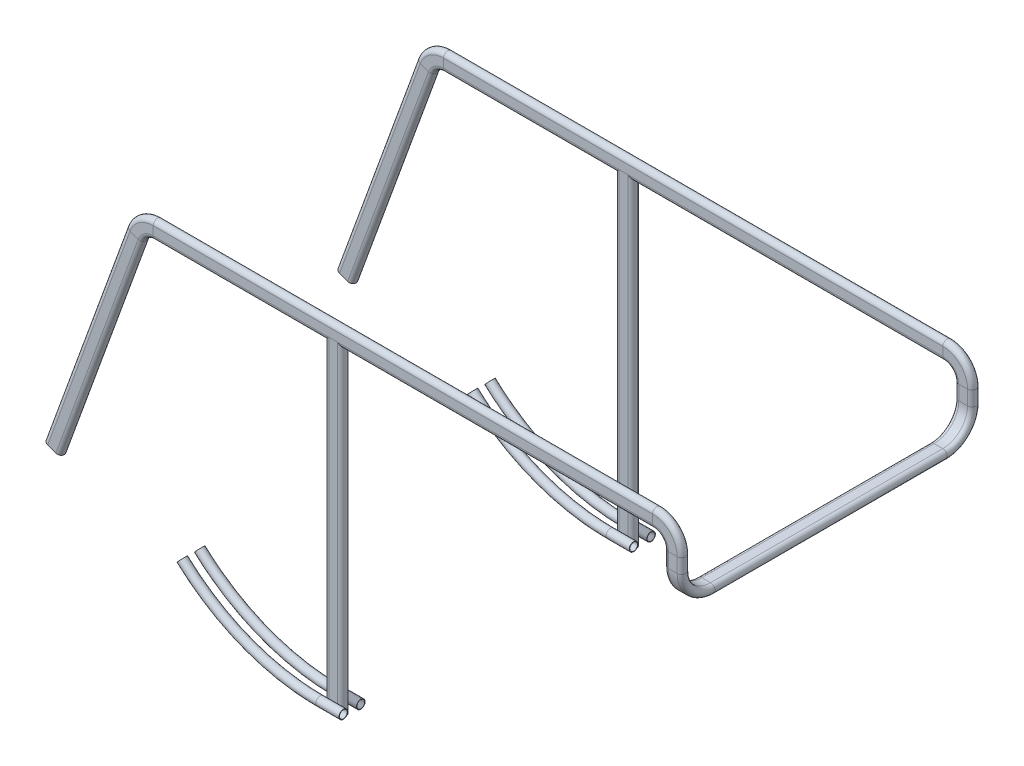
from build123d import *

# Parameters (mm, degrees)
SALIENTE_EXTRUIR1_START   = -15.0000001
SALIENTE_EXTRUIR1_DEPTH   = 1115.0000001
SALIENTE_EXTRUIR1_START_2 = -31
SALIENTE_EXTRUIR1_2_DEPTH = 62
CROQUIS7_R                = 15
CROQUIS7_R_2              = 13.5
SALIENTE_EXTRUIR4_DEPTH   = 80
SALIENTE_EXTRUIR4_2_DEPTH = 80
SALIENTE_EXTRUIR4_3_DEPTH = 80
SALIENTE_EXTRUIR4_4_DEPTH = 80
BARRER21_OUTLINE_R        = 15
BARRER21_OUTLINE_R_2      = 13.5
BARRER21_ANGLE            = 42.727262


with BuildPart() as part:
    # Barrer1: sweep along a curve in space
    with BuildLine() as barrer1_path:
        Line((0, 0, 0), (1100, 0, 0))
        ThreePointArc((1100, 0, 0), (1170.710678119, -29.289321881, 0), (1200, -100, 0))
        Line((1200, -100, 0), (1200, -150, 0))
        ThreePointArc((1200, -250, 100), (1200, -220.710678119, 29.289321881), (1200, -150, 0))
        Line((1200, -250, 100), (1200, -250, 900))
        ThreePointArc((1200, -250, 900), (1200, -220.710678119, 970.710678119), (1200, -150, 1000))
        Line((1200, -150, 1000), (1200, -100, 1000))
        ThreePointArc((1100, 0, 1000), (1170.710678119, -29.289321881, 1000), (1200, -100, 1000))
        Line((1100, 0, 1000), (0, 0, 1000))
    # Croquis1 → Barrer1 (sweep)
    with BuildSketch(Plane(origin=(0, 0, 0), x_dir=(0, 0, -1), z_dir=(1, 0, 0))):
        with BuildLine():
            Line((15, -15), (15, -45))
            ThreePointArc((15, -45), (0, -60), (-15, -45))
            Line((-15, -45), (-15, -15))
            ThreePointArc((-15, -15), (0, 0), (15, -15))
        make_face()
        with BuildLine():
            Line((13.5, -15), (13.5, -45))
            ThreePointArc((13.5, -45), (0, -58.5), (-13.5, -45))
            Line((-13.5, -45), (-13.5, -15))
            ThreePointArc((-13.5, -15), (0, -1.5), (13.5, -15))
        make_face(mode=Mode.SUBTRACT)
    sweep(path=barrer1_path.line)

    # Barrer8: sweep along a curve in space
    with BuildLine() as barrer8_path:
        Line((0, 0, 1000), (-619.979246179, 0, 1000))
        ThreePointArc((-619.979246179, 0, 1000), (-677.336889814, -18.084795571, 1000), (-713.948508258, -65.797985667, 1000))
        Line((-713.948508258, -65.797985667, 1000), (-997.818128993, -845.723358707, 1000))
    # Croquis2 → Barrer8 (sweep)
    with BuildSketch(Plane(origin=(0, 0, 0), x_dir=(0, 0, -1), z_dir=(1, 0, 0))):
        with BuildLine():
            Line((-1015, -45), (-1015, -15))
            ThreePointArc((-1015, -15), (-1000, 0), (-985, -15))
            Line((-985, -15), (-985, -45))
            ThreePointArc((-985, -45), (-1000, -60), (-1015, -45))
        make_face()
        with BuildLine():
            Line((-1013.5, -15), (-1013.5, -45))
            ThreePointArc((-1013.5, -45), (-1000, -58.5), (-986.5, -45))
            Line((-986.5, -45), (-986.5, -15))
            ThreePointArc((-986.5, -15), (-1000, -1.5), (-1013.5, -15))
        make_face(mode=Mode.SUBTRACT)
    sweep(path=barrer8_path.line)

    # Barrer17: sweep along a curve in space
    with BuildLine() as barrer17_path:
        Line((0, 0, 0), (-619.979246179, 0, 0))
        ThreePointArc((-619.979246179, 0, 0), (-677.336889814, -18.084795571, 0), (-713.948508258, -65.797985667, 0))
        Line((-713.948508258, -65.797985667, 0), (-992.422944232, -830.900210403, 0))
    # Croquis4 → Barrer17 (sweep)
    with BuildSketch(Plane(origin=(0, 0, 0), x_dir=(0, 0, -1), z_dir=(1, 0, 0))):
        with BuildLine():
            Line((-15, -15), (-15, -45))
            ThreePointArc((-15, -45), (0, -60), (15, -45))
            Line((15, -45), (15, -15))
            ThreePointArc((15, -15), (0, 0), (-15, -15))
        make_face()
        with BuildLine():
            Line((13.5, -15), (13.5, -45))
            ThreePointArc((13.5, -45), (0, -58.5), (-13.5, -45))
            Line((-13.5, -45), (-13.5, -15))
            ThreePointArc((-13.5, -15), (0, -1.5), (13.5, -15))
        make_face(mode=Mode.SUBTRACT)
    sweep(path=barrer17_path.line)


with BuildPart() as body_2:
    # Saliente-Extruir1: read off the stored shape, not the designer's step
    # Saliente-Extruir1 outline → Saliente-Extruir1 (new body)
    with BuildSketch(Plane(origin=(0, -60, 1000), x_dir=(-1, 0, 0), z_dir=(0, -1, 0)).offset(SALIENTE_EXTRUIR1_START)):
        with BuildLine():
            ThreePointArc((-15, 15), (-30, 0), (-15, -15))
            Line((-15, -15), (15, -15))
            ThreePointArc((15, -15), (30, 0), (15, 15))
            Line((15, 15), (-15, 15))
        make_face()
        with BuildLine():
            Line((15, -13.5), (-15, -13.5))
            ThreePointArc((-15, -13.5), (-28.5, 0), (-15, 13.5))
            Line((-15, 13.5), (15, 13.5))
            ThreePointArc((15, 13.5), (28.5, 0), (15, -13.5))
        make_face(mode=Mode.SUBTRACT)
    extrude(amount=SALIENTE_EXTRUIR1_DEPTH)

    # Saliente-Extruir1 2 outline → Saliente-Extruir1 2 (cut)
    with BuildSketch(Plane.YZ.offset(SALIENTE_EXTRUIR1_START_2)):
        with BuildLine():
            ThreePointArc((-45, 1015), (-60, 1000), (-45, 985))
            Line((-45, 985), (-45, 1015))
        make_face()
    extrude(amount=SALIENTE_EXTRUIR1_2_DEPTH, mode=Mode.SUBTRACT)


with BuildPart() as body_3:
    # Saliente-Extruir2: read off the stored shape, not the designer's step
    # Saliente-Extruir2: copy of body 2
    add(body_2.part.moved(Location((0, 0, -1000))))


with BuildPart() as body_4:
    # Croquis7 → Saliente-Extruir4 (new body)
    with BuildSketch(Plane.ZY.offset(30)):
        with Locations((30, -1130)):
            Circle(CROQUIS7_R)
        with Locations((30, -1130)):
            Circle(CROQUIS7_R_2, mode=Mode.SUBTRACT)
    extrude(amount=-SALIENTE_EXTRUIR4_DEPTH)


with BuildPart() as body_5:
    # Croquis7 → Saliente-Extruir4 2 (new body)
    with BuildSketch(Plane.ZY.offset(30)):
        with Locations((1030, -1130)):
            Circle(CROQUIS7_R)
        with Locations((1030, -1130)):
            Circle(CROQUIS7_R_2, mode=Mode.SUBTRACT)
    extrude(amount=-SALIENTE_EXTRUIR4_2_DEPTH)

    # Barrer21: read off the stored shape, not the designer's step
    # Barrer21 outline → Barrer21 (revolve)
    with BuildSketch(Plane(origin=(-30, -430, 0), x_dir=(-0.6785092728937077, -0.7345918367346945, 0), z_dir=(-0.7345918367346945, 0.6785092728937077, 0))):
        with Locations((700, 1030)):
            Circle(BARRER21_OUTLINE_R)
        with Locations((700, 1030)):
            Circle(BARRER21_OUTLINE_R_2, mode=Mode.SUBTRACT)
    revolve(axis=Axis((-30, -430, 0), (0, 0, 1)), revolution_arc=BARRER21_ANGLE)


with BuildPart() as body_6:
    # Croquis7 → Saliente-Extruir4 3 (new body)
    with BuildSketch(Plane.ZY.offset(30)):
        with Locations((-30, -1130)):
            Circle(CROQUIS7_R)
        with Locations((-30, -1130)):
            Circle(CROQUIS7_R_2, mode=Mode.SUBTRACT)
    extrude(amount=-SALIENTE_EXTRUIR4_3_DEPTH)


with BuildPart() as body_7:
    # Croquis7 → Saliente-Extruir4 4 (new body)
    with BuildSketch(Plane.ZY.offset(30)):
        with Locations((970, -1130)):
            Circle(CROQUIS7_R)
        with Locations((970, -1130)):
            Circle(CROQUIS7_R_2, mode=Mode.SUBTRACT)
    extrude(amount=-SALIENTE_EXTRUIR4_4_DEPTH)


with BuildPart() as body_8:
    # Simetría4: mirrored copy
    add(body_5.part.mirror(Plane.XY.offset(1000)))


with BuildPart() as body_9:
    # Simetría5: mirrored copy
    add(body_5.part.mirror(Plane.XY.offset(500)))


with BuildPart() as body_10:
    # Simetr_a5 2: mirrored copy
    add(body_8.part.mirror(Plane.XY.offset(500)))


solid = Compound([part.part, body_2.part, body_3.part, body_4.part, body_5.part, body_6.part, body_7.part, body_8.part, body_9.part, body_10.part])
